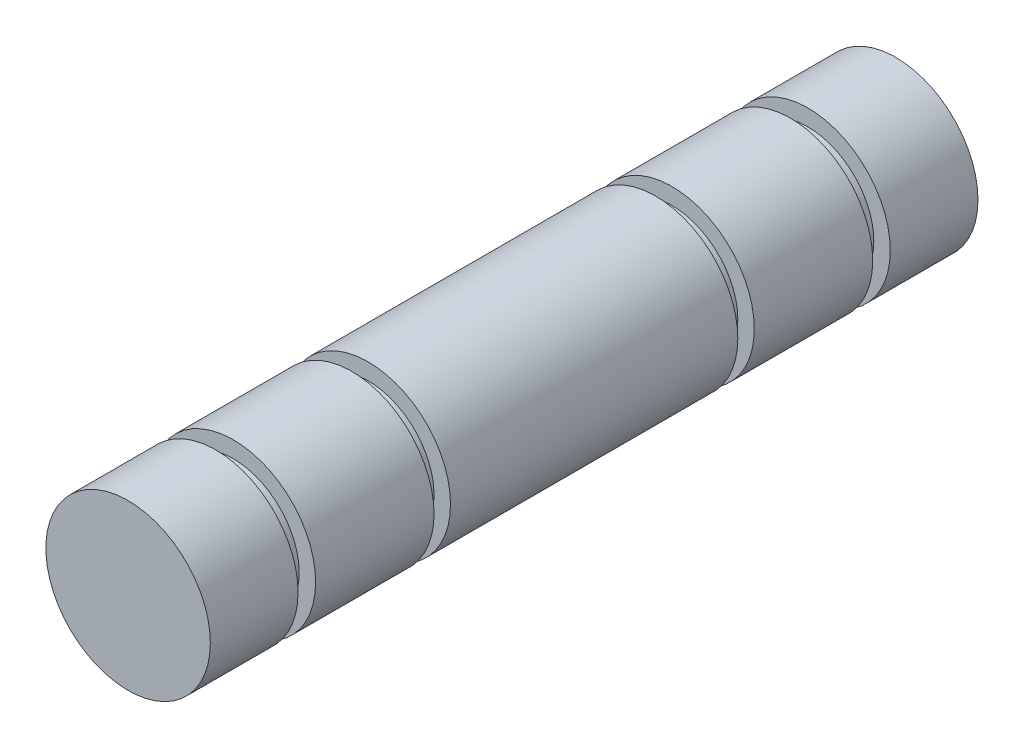
from build123d import *

# Parameters (mm, degrees)
SKETCH1_R           = 4.7625
BOSS_EXTRUDE1_DEPTH = 22.225
SKETCH2_W           = 0.9525
SKETCH2_H           = 1.016
SKETCH2_H_2         = 0.9525


with BuildPart() as part:
    # Sketch1 → Boss-Extrude1 (new, symmetric)
    with BuildSketch(Plane.XY):
        Circle(SKETCH1_R)
    extrude(amount=BOSS_EXTRUDE1_DEPTH, both=True)

    # Sketch2 → Cut-Revolve1 (revolve, cut)
    with BuildSketch(Plane(origin=(0, 0, 0), x_dir=(1, 0, 0), z_dir=(0, 1, 0))):
        with Locations((4.28625, 16.637)):
            Rectangle(SKETCH2_W, SKETCH2_H)
        with Locations((4.28625, -16.637)):
            Rectangle(SKETCH2_W, SKETCH2_H)
        with Locations((4.28625, 8.79475)):
            Rectangle(SKETCH2_W, SKETCH2_H_2)
        with Locations((4.28625, -8.79475)):
            Rectangle(SKETCH2_W, SKETCH2_H_2)
    revolve(axis=Axis((0, 0, 22.225), (0, 0, -1)), mode=Mode.SUBTRACT)


solid = part.part
